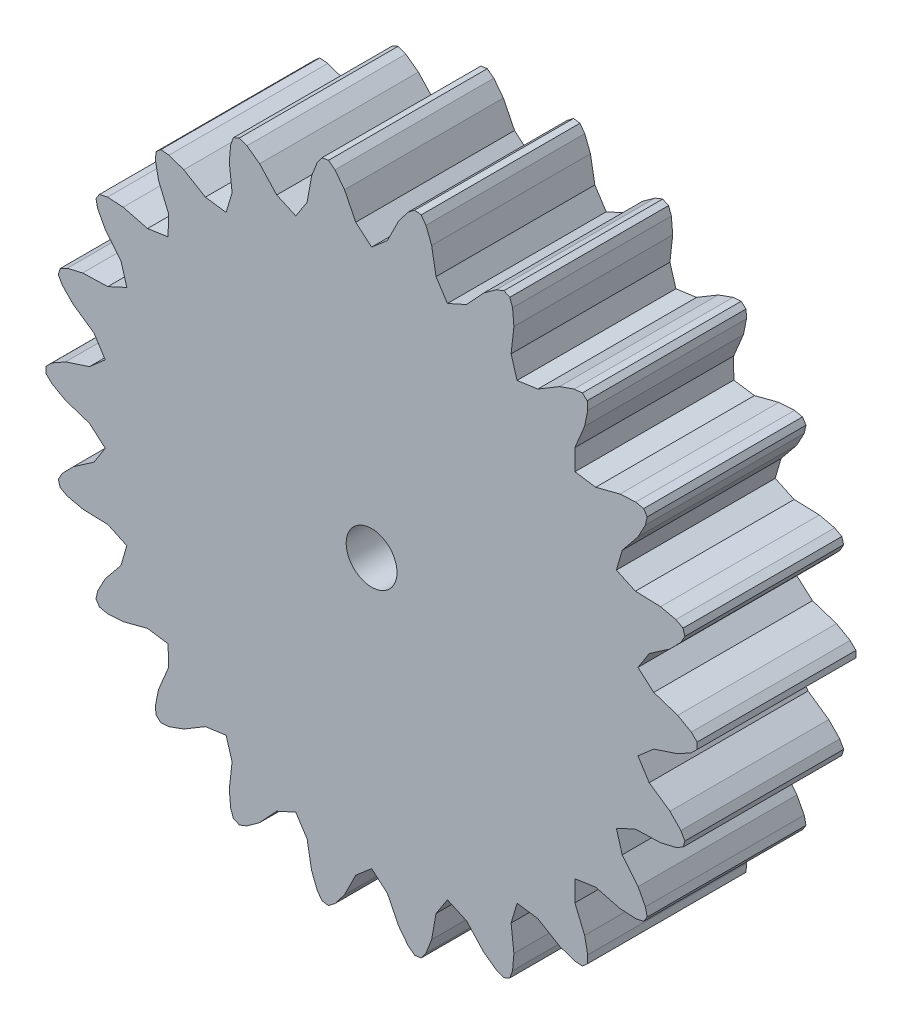
from build123d import *

# Parameters (mm, degrees)
SKETCH1_R               = 20.5
BOSS_EXTRUDE1_DEPTH     = 10
CUT_EXTRUDE1_DEPTH      = 31.66757245
CUT_EXTRUDE2_DEPTH      = 31.66757245
CUT_EXTRUDE2_DEPTH_BACK = 31.66757245
SKETCH4_R               = 1.6
CIRPATTERN1_COUNT       = 22


with BuildPart() as part:
    # Sketch1 → Boss-Extrude1 (new body)
    with BuildSketch(Plane.XY):
        Circle(SKETCH1_R)
    extrude(amount=BOSS_EXTRUDE1_DEPTH)

    # Sketch2 → Cut-Extrude1 (cut, through all)
    with BuildSketch(Plane.XY):
        Polygon((0, 16.944693036), (-0.998470792, 17.804120424), (-1.704297747, 19.225185361), (-2.306603416, 20.006300526), (-2.715384942, 20.31936723), (0, 24.503722989), (2.715384942, 20.31936723), (2.306603416, 20.006300526), (1.704297747, 19.225185361), (0.998470792, 17.804120424), align=None)
    cut_extrude1 = extrude(amount=CUT_EXTRUDE1_DEPTH, mode=Mode.SUBTRACT)

    # Sketch4 → Cut-Extrude2 (cut, two sides: drawn at the far end of the back side and taken through both)
    with BuildSketch(Plane.XY.offset(10).offset(-CUT_EXTRUDE2_DEPTH_BACK)):
        Circle(SKETCH4_R)
    extrude(amount=CUT_EXTRUDE2_DEPTH + CUT_EXTRUDE2_DEPTH_BACK, mode=Mode.SUBTRACT)

    # CirPattern1: Cut-Extrude1 ×22 about axis
    cirpattern1_axis = Axis((0, 0, 10), (0, 0, -1))
    for i in range(1, CIRPATTERN1_COUNT):
        add(cut_extrude1.rotate(cirpattern1_axis, i * 360 / CIRPATTERN1_COUNT), mode=Mode.SUBTRACT)


solid = part.part
